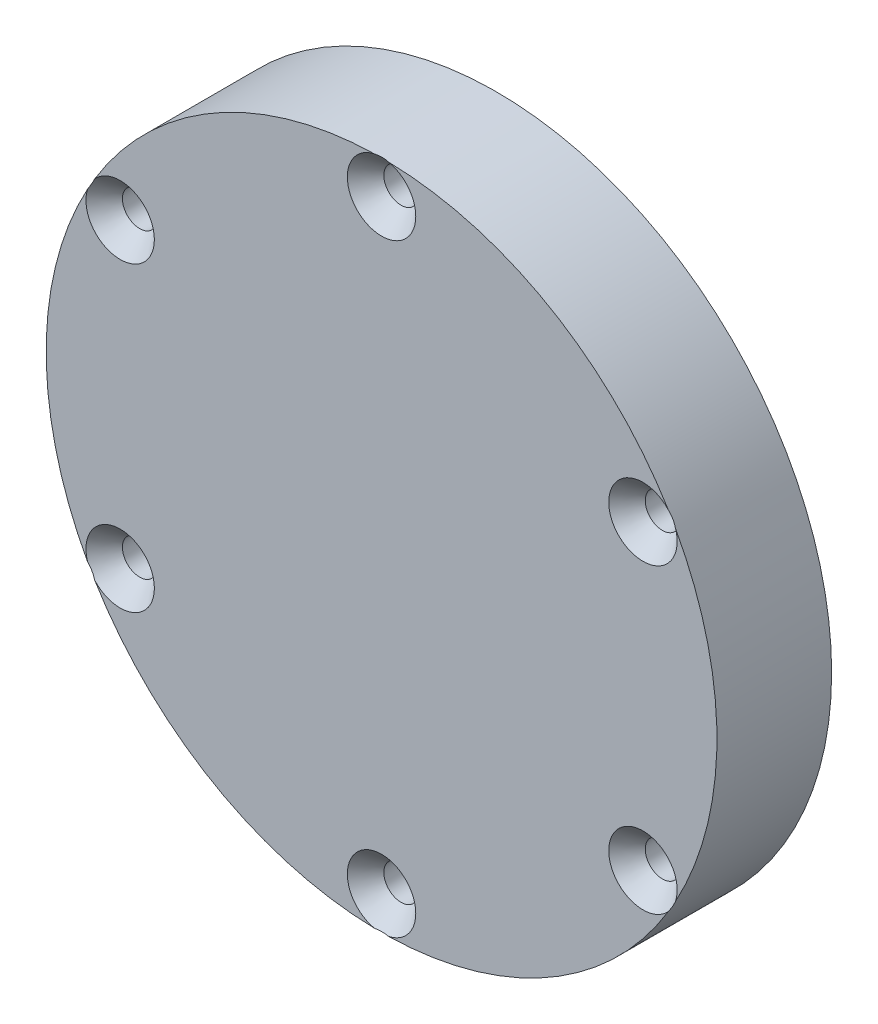
from build123d import *

# Parameters (mm, degrees)
SKETCH1_R                                         = 31.75
BOSS_EXTRUDE1_DEPTH                               = 10.8585
CSK_FOR_4_FLAT_HEAD_SOCKET_CAP_SCREW1_D           = 3.2639
CSK_FOR_4_FLAT_HEAD_SOCKET_CAP_SCREW1_CSINK_D     = 6.477
CSK_FOR_4_FLAT_HEAD_SOCKET_CAP_SCREW1_CSINK_ANGLE = 82
CIRPATTERN1_COUNT                                 = 6
CUT_EXTRUDE1_DEPTH                                = 8.47725
FILLET1_R                                         = 3.175
SKETCH5_R                                         = 4.7625
CUT_EXTRUDE2_DEPTH                                = 1.5875


with BuildPart() as part:
    # Sketch1 → Boss-Extrude1 (new body)
    with BuildSketch(Plane.XY):
        Circle(SKETCH1_R)
    extrude(amount=BOSS_EXTRUDE1_DEPTH)

    # CSK for #4 Flat Head Socket Cap Screw1 (through all)
    with Locations(Plane.XY.offset(10.8585)):
        with Locations((0, 28.575)):
            csk_for_4_flat_head_socket_cap_screw1 = CounterSinkHole(CSK_FOR_4_FLAT_HEAD_SOCKET_CAP_SCREW1_D / 2, CSK_FOR_4_FLAT_HEAD_SOCKET_CAP_SCREW1_CSINK_D / 2, counter_sink_angle=CSK_FOR_4_FLAT_HEAD_SOCKET_CAP_SCREW1_CSINK_ANGLE)

    # CirPattern1: CSK for #4 Flat Head Socket Cap Screw1 ×6 about axis
    cirpattern1_axis = Axis((0, 0, 10.8585), (0, 0, 1))
    for i in range(1, CIRPATTERN1_COUNT):
        add(csk_for_4_flat_head_socket_cap_screw1.rotate(cirpattern1_axis, i * 360 / CIRPATTERN1_COUNT), mode=Mode.SUBTRACT)

    # Sketch4 → Cut-Extrude1 (cut)
    with BuildSketch(Plane(origin=(0, 0, 0), x_dir=(-1, 0, 0), z_dir=(0, 0, -1))):
        with BuildLine():
            ThreePointArc((-3.158514815, 29.198411956), (-14.684375, 25.434083577), (-23.707309096, 17.334560046))
            ThreePointArc((-23.707309096, 17.334560046), (-21.958550427, 12.677775), (-26.865823911, 11.86385191))
            ThreePointArc((-26.865823911, 11.86385191), (-29.36875, 0), (-26.865823911, -11.86385191))
            ThreePointArc((-26.865823911, -11.86385191), (-21.958550427, -12.677775), (-23.707309096, -17.334560046))
            ThreePointArc((-23.707309096, -17.334560046), (-14.684375, -25.434083577), (-3.158514815, -29.198411956))
            ThreePointArc((-3.158514815, -29.198411956), (0, -25.35555), (3.158514815, -29.198411956))
            ThreePointArc((3.158514815, -29.198411956), (14.684375, -25.434083577), (23.707309096, -17.334560046))
            ThreePointArc((23.707309096, -17.334560046), (21.958550427, -12.677775), (26.865823911, -11.86385191))
            ThreePointArc((26.865823911, -11.86385191), (29.36875, 0), (26.865823911, 11.86385191))
            ThreePointArc((26.865823911, 11.86385191), (21.958550427, 12.677775), (23.707309096, 17.334560046))
            ThreePointArc((23.707309096, 17.334560046), (14.684375, 25.434083577), (3.158514815, 29.198411956))
            ThreePointArc((3.158514815, 29.198411956), (0, 25.35555), (-3.158514815, 29.198411956))
        make_face()
    extrude(amount=-CUT_EXTRUDE1_DEPTH, mode=Mode.SUBTRACT)

    # Fillet1
    fillet1_edges = [part.edges().sort_by_distance(p)[0] for p in [
        (3.158514815, 29.198411956, 4.238625),
        (-3.158514815, 29.198411956, 4.238625),
        (-23.707309096, 17.334560046, 4.238625),
        (-26.865823911, 11.86385191, 4.238625),
        (-26.865823911, -11.86385191, 4.238625),
        (-23.707309096, -17.334560046, 4.238625),
        (-3.158514815, -29.198411956, 4.238625),
        (3.158514815, -29.198411956, 4.238625),
        (23.707309096, -17.334560046, 4.238625),
        (26.865823911, -11.86385191, 4.238625),
        (23.707309096, 17.334560046, 4.238625),
        (26.865823911, 11.86385191, 4.238625),
    ]]
    fillet(fillet1_edges, radius=FILLET1_R)

    # Sketch5 → Cut-Extrude2 (cut)
    with BuildSketch(Plane(origin=(0, 0, 8.47725), x_dir=(-1, 0, 0), z_dir=(0, 0, -1))):
        Circle(SKETCH5_R)
    extrude(amount=-CUT_EXTRUDE2_DEPTH, mode=Mode.SUBTRACT)


solid = part.part
